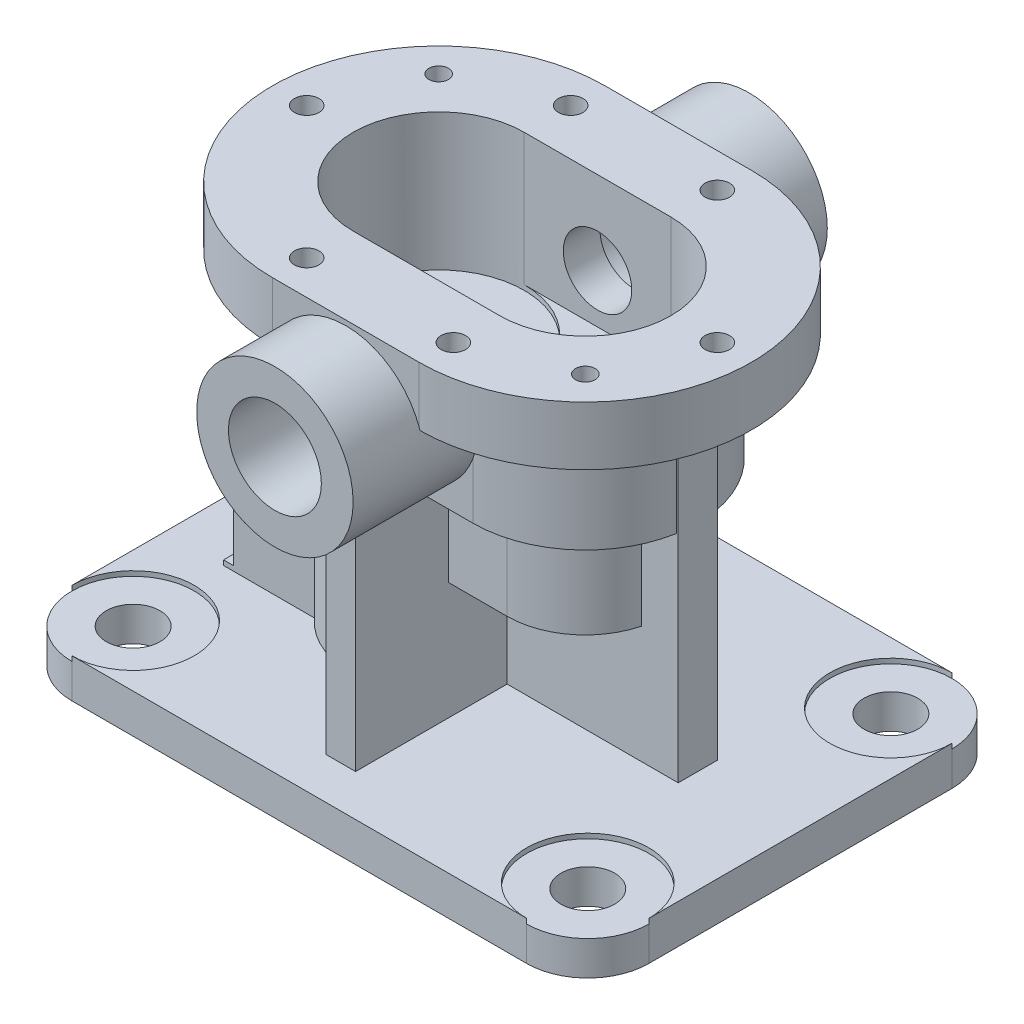
from build123d import *
from build123d.topology import SkipClean

# Parameters (mm, degrees)
EXTRUDE_1_DEPTH            = 8
CUT_EXTRUDE_START          = -1
SKETCH_3_R                 = 12.5
CUT_EXTRUDE_1_DEPTH        = 1
SKETCH_4_R                 = 5.5
CUT_EXTRUDE_2_DEPTH        = 7
MIRROR_START               = -1
MIRROR_3_COPY_1_SKETCH_R   = 12.5
MIRROR_3_COPY_1_DEPTH      = 1
MIRROR_3_COPY_2_SKETCH_R   = 5.5
MIRROR_3_COPY_2_DEPTH      = 7
EXTRUDE_2_DEPTH            = 12
EXTRUDE_3_DEPTH            = 22
EXTRUDE_4_DEPTH            = 20
SKETCH_10_R                = 18
EXTRUDE_5_DEPTH            = 24
EXTRUDE_9_DEPTH            = 14.5
EXTRUDE_9_DEPTH_BACK       = 82.5
SKETCH_20_R                = 16
CUT_EXTRUDE_3_DEPTH        = 27
CUT_EXTRUDE_4_DEPTH        = 1
SKETCH_14_R                = 7
CUT_EXTRUDE_6_DEPTH        = 67
SKETCH_15_R                = 26
EXTRUDE_6_DEPTH            = 3
SKETCH_16_R                = 20
CUT_EXTRUDE_7_DEPTH        = 3
EXTRUDE_7_DEPTH            = 17
SKETCH_19_W                = 24
SKETCH_19_H                = 1
EXTRUDE_8_DEPTH            = 2
SKETCH_22_R                = 2
CUT_EXTRUDE_8_DEPTH        = 14.5
HOLE_WIZARD_G1_4_1_D       = 11.8
HOLE_WIZARD_G1_4_1_DEPTH   = 12
HOLE_WIZARD_G1_4_1_TIP     = 3.545077652
SKETCH_26_R                = 3.5
CUT_EXTRUDE_9_DEPTH        = 26.5
HOLE_WIZARD_G3_4_1_D       = 24.5
HOLE_WIZARD_G3_4_1_DEPTH   = 28
HOLE_WIZARD_G3_4_1_TIP     = 7.360542583
RIB_1_REACH                = 117.018
SKETCH_30_WALL_W           = 277.036953786
SKETCH_30_WALL_H           = 6
RIB_3_REACH                = 117.018
SKETCH_31_WALL_W           = 276.036953786
SKETCH_31_WALL_H           = 8
HOLE_START                 = 74
HOLE_WIZARD_M6_1_OUTLINE_R = 2.5
HOLE_WIZARD_M6_1_DEPTH     = 12
HOLE_WIZARD_M6_3_OUTLINE_R = 2.5
HOLE_WIZARD_M6_3_DEPTH     = 12
SKETCH_37_R                = 7
CUT_EXTRUDE_10_DEPTH       = 121


# Read off the part's stored shape, not the designer's step: M6 螺纹孔1, M6 螺纹孔3
with BuildPart() as part:
    # 草图1 → 凸台-拉伸1 (new body)
    with BuildSketch(Plane(origin=(0, 0, 0), x_dir=(1, 0, 0), z_dir=(0, 1, 0))):
        with BuildLine():
            Line((46.5, 43.5), (-46.5, 43.5))
            ThreePointArc((-46.5, 43.5), (-55.338834765, 39.838834765), (-59, 31))
            Line((-59, 31), (-59, -31))
            ThreePointArc((-59, -31), (-55.338834765, -39.838834765), (-46.5, -43.5))
            Line((-46.5, -43.5), (46.5, -43.5))
            ThreePointArc((46.5, -43.5), (55.338834765, -39.838834765), (59, -31))
            Line((59, -31), (59, 31))
            ThreePointArc((59, 31), (55.338834765, 39.838834765), (46.5, 43.5))
        make_face()
    extrude(amount=EXTRUDE_1_DEPTH)

    # 草图3 → 切除-拉伸1 (cut)
    with BuildSketch(Plane(origin=(0, 8, 0), x_dir=(1, 0, 0), z_dir=(0, 1, 0)).offset(CUT_EXTRUDE_START)):
        with Locations((-46.5, 31)):
            Circle(SKETCH_3_R)
    cut_extrude_1 = extrude(amount=CUT_EXTRUDE_1_DEPTH, mode=Mode.SUBTRACT)

    # 草图4 → 切除-拉伸2 (cut)
    with BuildSketch(Plane(origin=(0, 7, 0), x_dir=(1, 0, 0), z_dir=(0, 1, 0))):
        with Locations(Location((-46.5, 31, 0), (0, 0, 270))):
            Circle(SKETCH_4_R)
    cut_extrude_2 = extrude(amount=-CUT_EXTRUDE_2_DEPTH, mode=Mode.SUBTRACT)

    # 镜向2: 切除-拉伸1, 切除-拉伸2 across plane
    add(cut_extrude_1.mirror(Plane(origin=(0, 0, 0), x_dir=(0, 0, 1), z_dir=(1, 0, 0))), mode=Mode.SUBTRACT)
    add(cut_extrude_2.mirror(Plane(origin=(0, 0, 0), x_dir=(0, 0, 1), z_dir=(1, 0, 0))), mode=Mode.SUBTRACT)

    # 镜向3: 切除-拉伸1, 切除-拉伸2 across plane
    add(cut_extrude_1.mirror(Plane.XY), mode=Mode.SUBTRACT)
    add(cut_extrude_2.mirror(Plane.XY), mode=Mode.SUBTRACT)

    # 镜向3 copy 1 sketch → 镜向3 copy 1 (cut)
    with BuildSketch(Plane(origin=(0, 8, 0), x_dir=(-1, 0, 0), z_dir=(0, 1, 0)).offset(MIRROR_START)):
        with Locations((-46.5, 31)):
            Circle(MIRROR_3_COPY_1_SKETCH_R)
    extrude(amount=MIRROR_3_COPY_1_DEPTH, mode=Mode.SUBTRACT)

    # 镜向3 copy 2 sketch → 镜向3 copy 2 (cut)
    with BuildSketch(Plane(origin=(0, 7, 0), x_dir=(-1, 0, 0), z_dir=(0, 1, 0))):
        with Locations(Location((-46.5, 31, 0), (0, 0, 270))):
            Circle(MIRROR_3_COPY_2_SKETCH_R)
    extrude(amount=-MIRROR_3_COPY_2_DEPTH, mode=Mode.SUBTRACT)



with BuildPart() as body_2:
    # 草图5 → 凸台-拉伸2 (new body)
    with BuildSketch(Plane(origin=(0, 86, 0), x_dir=(1, 0, 0), z_dir=(0, 1, 0))):
        with BuildLine():
            Line((-15, 34), (15, 34))
            ThreePointArc((15, 34), (49, 0), (15, -34))
            Line((15, -34), (-15, -34))
            ThreePointArc((-15, -34), (-49, 0), (-15, 34))
        make_face()
    extrude(amount=-EXTRUDE_2_DEPTH)

    # 草图7 → 凸台-拉伸3 (add)
    with BuildSketch(Plane.XZ.offset(-74)):
        with BuildLine():
            Line((-15, 23), (15, 23))
            ThreePointArc((15, 23), (38, 0), (15, -23))
            Line((15, -23), (-15, -23))
            ThreePointArc((-15, -23), (-38, 0), (-15, 23))
        make_face()
    extrude(amount=EXTRUDE_3_DEPTH)

    # 草图8 → 凸台-拉伸4 (add)
    with BuildSketch(Plane.XZ.offset(-52)):
        with BuildLine():
            Line((-15, 16), (15, 16))
            ThreePointArc((15, 16), (31, 0), (15, -16))
            Line((15, -16), (-15, -16))
            ThreePointArc((-15, -16), (-31, 0), (-15, 16))
        make_face()
    extrude(amount=EXTRUDE_4_DEPTH)


with BuildPart() as part_1:
    add(part.part)

    add(body_2.part)  # 凸台-拉伸5 merges body 2
    # 草图10 → 凸台-拉伸5 (add)
    with BuildSketch(Plane.XZ.offset(-32)):
        with Locations(Location((-15, 0, 0), (0, 0, 62.733955549))):
            Circle(SKETCH_10_R)
    extrude(amount=EXTRUDE_5_DEPTH)

    # 草图20 → 凸台-拉伸9 (add, two sides: drawn at the far end of the back side and taken through both)
    with BuildSketch(Plane.XY.offset(34).offset(-EXTRUDE_9_DEPTH_BACK)):
        with Locations((0, 69)):
            Circle(SKETCH_20_R)
    extrude(amount=EXTRUDE_9_DEPTH + EXTRUDE_9_DEPTH_BACK)

    # 草图6 → 切除-拉伸3 (cut)
    with BuildSketch(Plane(origin=(0, 86, 0), x_dir=(1, 0, 0), z_dir=(0, 1, 0))):
        with BuildLine():
            Line((-15, 17.5), (15, 17.5))
            ThreePointArc((15, 17.5), (32.5, 0), (15, -17.5))
            Line((15, -17.5), (-15, -17.5))
            ThreePointArc((-15, -17.5), (-32.5, 0), (-15, 17.5))
        make_face()
    extrude(amount=-CUT_EXTRUDE_3_DEPTH, mode=Mode.SUBTRACT)

    # 草图11 → 切除-拉伸4 (cut)
    with SkipClean():  # the faces are left unmerged after this step: merging them gives an invalid solid
        with BuildSketch(Plane(origin=(0, 59, 0), x_dir=(1, 0, 0), z_dir=(0, 1, 0))):
            with BuildLine():
                ThreePointArc((0, -9.013878189), (32.5, 0), (0, 9.013878189))
                ThreePointArc((0, 9.013878189), (-32.5, 0), (0, -9.013878189))
            make_face()
        extrude(amount=-CUT_EXTRUDE_4_DEPTH, mode=Mode.SUBTRACT)

    # 草图13 → 切除-旋转1 (revolve, cut)
    with SkipClean():  # the faces are left unmerged after this step: merging them gives an invalid solid
        with BuildSketch(Plane.XY, mode=Mode.PRIVATE) as cut_revolve_1_sk:
            Polygon((15, 58), (25, 58), (25, 42.301773752), (15, 36.293167562), align=None)
        cut_revolve_1 = revolve(cut_revolve_1_sk.sketch.rotate(Axis((15, 58, 0), (0, -1, 0)), 180), axis=Axis((15, 58, 0), (0, -1, 0)), mode=Mode.SUBTRACT)

    # 镜向4: 切除-旋转1 across plane
    with SkipClean():  # the faces are left unmerged after this step: merging them gives an invalid solid
        add(cut_revolve_1.mirror(Plane(origin=(0, 0, 0), x_dir=(0, 0, 1), z_dir=(1, 0, 0))), mode=Mode.SUBTRACT)

    # 草图14 → 切除-拉伸6 (cut)
    with SkipClean():  # the faces are left unmerged after this step: merging them gives an invalid solid
        with BuildSketch(Plane(origin=(0, 58, 0), x_dir=(1, 0, 0), z_dir=(0, 1, 0))):
            with Locations(Location((-15, 0, 0), (0, 0, 270))):
                Circle(SKETCH_14_R)
        extrude(amount=-CUT_EXTRUDE_6_DEPTH, mode=Mode.SUBTRACT)

    # 草图15 → 凸台-拉伸6 (add)
    with SkipClean():  # the faces are left unmerged after this step: merging them gives an invalid solid
        with BuildSketch(Plane(origin=(0, 0, 0), x_dir=(1, 0, 0), z_dir=(0, 1, 0))):
            with Locations(Location((-15, 0, 0), (0, 0, 270))):
                Circle(SKETCH_15_R)
        extrude(amount=-EXTRUDE_6_DEPTH)

    # 草图16 → 切除-拉伸7 (cut)
    with SkipClean():  # the faces are left unmerged after this step: merging them gives an invalid solid
        with BuildSketch(Plane.XZ.offset(3)):
            with Locations(Location((-15, 0, 0), (0, 0, 270))):
                Circle(SKETCH_16_R)
        extrude(amount=-CUT_EXTRUDE_7_DEPTH, mode=Mode.SUBTRACT)

    # 草图18 → 凸台-拉伸7 (add)
    with SkipClean():  # the faces are left unmerged after this step: merging them gives an invalid solid
        with BuildSketch(Plane(origin=(-45, 0, 0), x_dir=(0, 0, -1), z_dir=(1, 0, 0))):
            with BuildLine():
                Line((-12, 20), (-12, 8))
                Line((-12, 8), (12, 8))
                Line((12, 8), (12, 20))
                ThreePointArc((12, 20), (0, 32), (-12, 20))
            make_face()
        extrude(amount=EXTRUDE_7_DEPTH)

    # 草图19 → 凸台-拉伸8 (add)
    with SkipClean():  # the faces are left unmerged after this step: merging them gives an invalid solid
        with BuildSketch(Plane.ZY.offset(45)):
            with Locations((0, 8.5)):
                Rectangle(SKETCH_19_W, SKETCH_19_H)
        extrude(amount=EXTRUDE_8_DEPTH)

    # 草图22 → 切除-拉伸8 (cut)
    with SkipClean():  # the faces are left unmerged after this step: merging them gives an invalid solid
        with BuildSketch(Plane(origin=(0, 86, 0), x_dir=(1, 0, 0), z_dir=(0, 1, 0))):
            with Locations(Location((34.091883092, -19.091883092, 0), (0, 0, 270))):
                Circle(SKETCH_22_R)
            with Locations(Location((-34.091883092, 19.091883092, 0), (0, 0, 270))):
                Circle(SKETCH_22_R)
        extrude(amount=-CUT_EXTRUDE_8_DEPTH, mode=Mode.SUBTRACT)

    # G1/4 螺纹孔1
    with Locations(Plane(origin=(-45, 20, 0), x_dir=(0, 0, -1), z_dir=(-1, 0, 0))):
        with Locations((0, 0)):
            Hole(HOLE_WIZARD_G1_4_1_D / 2, depth=HOLE_WIZARD_G1_4_1_DEPTH)
            with Locations((0, 0, -(HOLE_WIZARD_G1_4_1_DEPTH + HOLE_WIZARD_G1_4_1_TIP / 2))):  # 118° drill point
                Cone(0, HOLE_WIZARD_G1_4_1_D / 2, HOLE_WIZARD_G1_4_1_TIP, mode=Mode.SUBTRACT)

    # 草图26 → 切除-拉伸9 (cut)
    with SkipClean():  # the faces are left unmerged after this step: merging them gives an invalid solid
        with BuildSketch(Plane.ZY.offset(45)):
            with Locations((0, 20)):
                Circle(SKETCH_26_R)
        extrude(amount=-CUT_EXTRUDE_9_DEPTH, mode=Mode.SUBTRACT)

    # G3/4 螺纹孔1
    with Locations(Plane(origin=(-15, 0, 0), x_dir=(0, 0, -1), z_dir=(0, -1, 0))):
        with Locations((0, 0)):
            Hole(HOLE_WIZARD_G3_4_1_D / 2, depth=HOLE_WIZARD_G3_4_1_DEPTH)
            with Locations((0, 0, -(HOLE_WIZARD_G3_4_1_DEPTH + HOLE_WIZARD_G3_4_1_TIP / 2))):  # 118° drill point
                Cone(0, HOLE_WIZARD_G3_4_1_D / 2, HOLE_WIZARD_G3_4_1_TIP, mode=Mode.SUBTRACT)

    # 草图29 → G1/2 螺纹孔1 (revolve, cut)
    with SkipClean():  # the faces are left unmerged after this step: merging them gives an invalid solid
        with BuildSketch(Plane(origin=(0, 69, -48.5), x_dir=(0, 1, 0), z_dir=(1, 0, 0))):
            Polygon((0, 0), (0, 27.708175881), (9.5, 22), (9.5, 0), align=None)
        hole_wizard_g1_2_1 = revolve(axis=Axis((0, 69, -54.85), (0, 0, 1)), mode=Mode.SUBTRACT)

    # 镜向5: G1/2 螺纹孔1 across plane
    with SkipClean():  # the faces are left unmerged after this step: merging them gives an invalid solid
        add(hole_wizard_g1_2_1.mirror(Plane.XY), mode=Mode.SUBTRACT)

    # 草图30 wall → 筋1 (add, up to next)
    with BuildSketch(Plane(origin=(0, 30.5, -35), x_dir=(0, -1, 0), z_dir=(0, 0, -1)), mode=Mode.PRIVATE) as rib_1_sk1:
        Rectangle(SKETCH_30_WALL_W, SKETCH_30_WALL_H)
    rib_1_tool1 = extrude(rib_1_sk1.sketch, amount=-RIB_1_REACH, mode=Mode.PRIVATE) - part_1.part
    rib_1 = rib_1_tool1.solids().sort_by_distance((0, 30.5, -35))[0]
    add(rib_1)

    # 镜向6: 筋1 across plane
    with SkipClean():  # the faces are left unmerged after this step: merging them gives an invalid solid
        add(rib_1.mirror(Plane.XY))

    # 草图31 wall → 筋3 (add, up to next)
    with BuildSketch(Plane(origin=(38, 30, 0), x_dir=(0, 1, 0), z_dir=(-1, 0, 0)), mode=Mode.PRIVATE) as rib_3_sk1:
        Rectangle(SKETCH_31_WALL_W, SKETCH_31_WALL_H)
    rib_3_tool1 = extrude(rib_3_sk1.sketch, amount=RIB_3_REACH, mode=Mode.PRIVATE) - part_1.part
    add(rib_3_tool1.solids().sort_by_distance((38, 30, 0))[0])

    # M6 螺纹孔1 outline → M6 螺纹孔1 (cut)
    with SkipClean():  # the faces are left unmerged after this step: merging them gives an invalid solid
        with BuildSketch(Plane(origin=(0, 0, 0), x_dir=(1, 0, 0), z_dir=(0, 1, 0)).offset(HOLE_START)):
            with Locations((15, 27)):
                Circle(HOLE_WIZARD_M6_1_OUTLINE_R)
        hole_wizard_m6_1 = extrude(amount=HOLE_WIZARD_M6_1_DEPTH, mode=Mode.SUBTRACT)

    # M6 螺纹孔3 outline → M6 螺纹孔3 (cut)
    with SkipClean():  # the faces are left unmerged after this step: merging them gives an invalid solid
        with BuildSketch(Plane(origin=(0, 0, 0), x_dir=(1, 0, 0), z_dir=(0, 1, 0)).offset(HOLE_START)):
            with Locations((-15, 27)):
                Circle(HOLE_WIZARD_M6_3_OUTLINE_R)
        hole_wizard_m6_3 = extrude(amount=HOLE_WIZARD_M6_3_DEPTH, mode=Mode.SUBTRACT)

    # 草图35 → M6 螺纹孔2 (revolve, cut)
    with SkipClean():  # the faces are left unmerged after this step: merging them gives an invalid solid
        with BuildSketch(Plane(origin=(42, 86, 0), x_dir=(0, 0, 1), z_dir=(1, 0, 0))):
            Polygon((0, 0), (0, 13.502151548), (2.5, 12), (2.5, 0), align=None)
        hole_wizard_m6_2 = revolve(axis=Axis((42, 92.35, 0), (0, -1, 0)), mode=Mode.SUBTRACT)

    # 镜向7: M6 螺纹孔2 across plane
    with SkipClean():  # the faces are left unmerged after this step: merging them gives an invalid solid
        add(hole_wizard_m6_2.mirror(Plane(origin=(0, 0, 0), x_dir=(0, 0, 1), z_dir=(1, 0, 0))), mode=Mode.SUBTRACT)

    # 镜向10: M6 螺纹孔1, M6 螺纹孔3 across plane
    with SkipClean():  # the faces are left unmerged after this step: merging them gives an invalid solid
        add(hole_wizard_m6_1.mirror(Plane.XY), mode=Mode.SUBTRACT)
        add(hole_wizard_m6_3.mirror(Plane.XY), mode=Mode.SUBTRACT)

    # 草图37 → 切除-拉伸10 (cut)
    with SkipClean():  # the faces are left unmerged after this step: merging them gives an invalid solid
        with BuildSketch(Plane(origin=(0, 0, -48.5), x_dir=(-1, 0, 0), z_dir=(0, 0, -1))):
            with Locations(Location((0, 69, 0), (0, 0, 180))):
                Circle(SKETCH_37_R)
        extrude(amount=-CUT_EXTRUDE_10_DEPTH, mode=Mode.SUBTRACT)


solid = part_1.part
